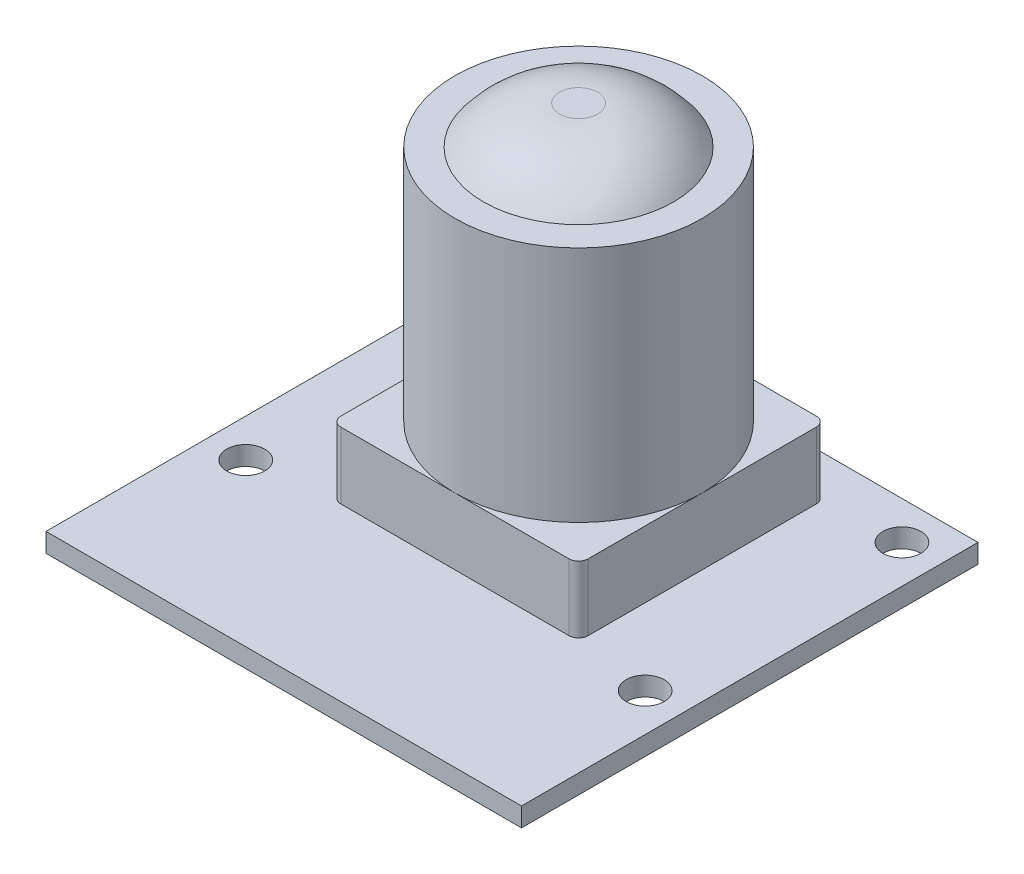
from build123d import *

# Parameters (mm, degrees)
SKETCH_1_W      = 25
SKETCH_1_H      = 24
SKETCH_1_R      = 1
EXTRUDE_1_DEPTH = 1
SKETCH_3_R      = 6.5
EXTRUDE_4_DEPTH = 16
EXTRUDE_5_DEPTH = 3.5
SKETCH_5_R      = 5
EXTRUDE_6_DEPTH = 2
FILLET_1_R      = 5
SKETCH_10_R     = 1.5
EXTRUDE_7_DEPTH = 1
FILLET_2_R      = 1


# Some blends are built 0.0001 mm under size
with BuildPart() as part:
    # Эскиз1 → Бобышка-Вытянуть1 (new body)
    with BuildSketch(Plane(origin=(0, 0, 0), x_dir=(1, 0, 0), z_dir=(0, 1, 0))):
        with Locations((-12.5, 12)):
            Rectangle(SKETCH_1_W, SKETCH_1_H)
        with Locations(Location((-23, 22, 0), (0, 0, 270))):
            Circle(SKETCH_1_R, mode=Mode.SUBTRACT)
        with Locations(Location((-2, 22, 0), (0, 0, 270))):
            Circle(SKETCH_1_R, mode=Mode.SUBTRACT)
        with Locations(Location((-23, 8.5, 0), (0, 0, 270))):
            Circle(SKETCH_1_R, mode=Mode.SUBTRACT)
        with Locations(Location((-2, 8.5, 0), (0, 0, 270))):
            Circle(SKETCH_1_R, mode=Mode.SUBTRACT)
    extrude(amount=EXTRUDE_1_DEPTH)

    # Эскиз3 → Бобышка-Вытянуть4 (add)
    with BuildSketch(Plane(origin=(0, 1, 0), x_dir=(1, 0, 0), z_dir=(0, 1, 0))):
        with Locations(Location((-12.5, 15.5, 0), (0, 0, 270))):
            Circle(SKETCH_3_R)
    extrude(amount=EXTRUDE_4_DEPTH)

    # Эскиз3<5> → Бобышка-Вытянуть5 (add)
    with BuildSketch(Plane(origin=(0, 1, 0), x_dir=(1, 0, 0), z_dir=(0, 1, 0))):
        with BuildLine():
            Line((-19, 21.5), (-19, 9.5))
            ThreePointArc((-19, 9.5), (-18.853553391, 9.146446609), (-18.5, 9))
            Line((-18.5, 9), (-6.5, 9))
            ThreePointArc((-6.5, 9), (-6.146446609, 9.146446609), (-6, 9.5))
            Line((-6, 9.5), (-6, 21.5))
            ThreePointArc((-6, 21.5), (-6.146446609, 21.853553391), (-6.5, 22))
            Line((-6.5, 22), (-18.5, 22))
            ThreePointArc((-18.5, 22), (-18.853553391, 21.853553391), (-19, 21.5))
        make_face()
    extrude(amount=EXTRUDE_5_DEPTH)

    # Эскиз5 → Бобышка-Вытянуть6 (add)
    with BuildSketch(Plane(origin=(0, 17, 0), x_dir=(1, 0, 0), z_dir=(0, 1, 0))):
        with Locations(Location((-12.5, 15.5, 0), (0, 0, 270))):
            Circle(SKETCH_5_R)
    extrude(amount=EXTRUDE_6_DEPTH)

    # Скругление1
    # the kernel refuses this fillet: 5 mm, written as the material it takes off along each edge
    with BuildSketch(Plane(origin=(-12.5, 19, -15.5), x_dir=(0, 0, 1), z_dir=(-1, 0, 0))) as fillet_1_piece_1:
        with BuildLine():
            CenterArc((1, -5), FILLET_1_R, 36.869897646, 53.130102354)
            Line((1, 0), (1, 0.1))
            Line((1, 0.1), (5, 0.1))
            Line((5, 0.1), (5.1, 0))
            ThreePointArc((5.1, 0), (5.1, -1), (5.08, -1.94))
            Line((5.08, -1.94), (5, -2))
        make_face()
    revolve(axis=Axis((-12.5, 19, -15.5), (0, 1, 0)), mode=Mode.SUBTRACT)

    # Эскиз10 → Бобышка-Вытянуть7 (add)
    with BuildSketch(Plane.XZ):
        with Locations(Location((-21.5, -15.5, 0), (0, 0, 90))):
            Circle(SKETCH_10_R)
        with Locations(Location((-3.5, -15.5, 0), (0, 0, 90))):
            Circle(SKETCH_10_R)
    extrude(amount=EXTRUDE_7_DEPTH)

    # Скругление2
    fillet_2_edges = [part.edges().sort_by_distance(p)[0] for p in [
        (-21.5, -1, -17),
        (-3.5, -1, -17),
    ]]
    fillet(fillet_2_edges, radius=FILLET_2_R - 0.0001)  # a hair under: the kernel refuses the full size


solid = part.part
